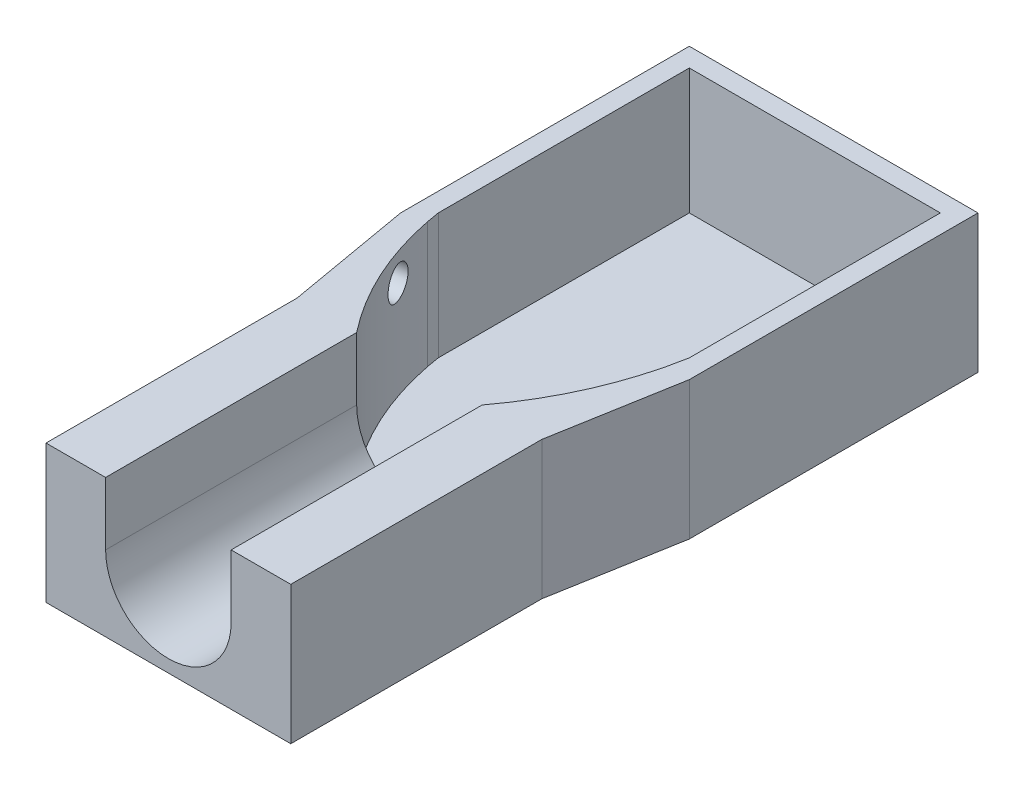
from build123d import *

# Parameters (mm, degrees)
SKETCH1_W           = 46
SKETCH1_H           = 46
SKETCH1_W_2         = 40
SKETCH1_H_2         = 40
BOSS_EXTRUDE1_DEPTH = 20
SKETCH2_W           = 46
SKETCH2_H           = 46
BOSS_EXTRUDE2_DEPTH = 2
BOSS_EXTRUDE3_DEPTH = 22
CUT_EXTRUDE1_DEPTH  = 20
BOSS_EXTRUDE5_DEPTH = 2
BOSS_EXTRUDE6_DEPTH = 40
BOSS_EXTRUDE8_DEPTH = 20
SKETCH12_R          = 2.55
CUT_EXTRUDE4_DEPTH  = 20


with BuildPart() as part:
    # Sketch1 → Boss-Extrude1 (new body)
    with BuildSketch(Plane(origin=(0, 0, 0), x_dir=(1, 0, 0), z_dir=(0, 1, 0))):
        Rectangle(SKETCH1_W, SKETCH1_H)
        Rectangle(SKETCH1_W_2, SKETCH1_H_2, mode=Mode.SUBTRACT)
    extrude(amount=BOSS_EXTRUDE1_DEPTH)

    # Sketch2 → Boss-Extrude2 (add)
    with BuildSketch(Plane.XZ):
        Rectangle(SKETCH2_W, SKETCH2_H)
    extrude(amount=BOSS_EXTRUDE2_DEPTH)

    # Sketch3 → Boss-Extrude3 (add)
    with BuildSketch(Plane(origin=(0, 20, 0), x_dir=(1, 0, 0), z_dir=(0, 1, 0))):
        Polygon((-16, -43), (-19.47826087, -23), (-23, -23), (-19.5, -43), align=None)
        Polygon((23, -23), (19.47826087, -23), (16, -43), (19.5, -43), align=None)
    extrude(amount=-BOSS_EXTRUDE3_DEPTH)

    # Sketch3<3> → Cut-Extrude1 (cut)
    with BuildSketch(Plane(origin=(0, 20, 0), x_dir=(1, 0, 0), z_dir=(0, 1, 0))):
        Polygon((20, -20), (-20, -20), (-19.47826087, -23), (19.47826087, -23), align=None)
    extrude(amount=-CUT_EXTRUDE1_DEPTH, mode=Mode.SUBTRACT)

    # Sketch5 → Boss-Extrude5 (add)
    with BuildSketch(Plane.XZ.offset(2)):
        Polygon((-16, 43), (-19.47826087, 23), (19.47826087, 23), (16, 43), align=None)
    extrude(amount=-BOSS_EXTRUDE5_DEPTH)

    # Sketch6 → Boss-Extrude6 (add)
    with BuildSketch(Plane.XY.offset(43)):
        with BuildLine():
            Line((-10, 10), (-10, 20))
            Line((-10, 20), (-19.5, 20))
            Line((-19.5, 20), (-19.5, -2))
            Line((-19.5, -2), (19.5, -2))
            Line((19.5, -2), (19.5, 20))
            Line((19.5, 20), (10, 20))
            Line((10, 20), (10, 10))
            ThreePointArc((10, 10), (0, 0), (-10, 10))
        make_face()
    extrude(amount=BOSS_EXTRUDE6_DEPTH)

    # Sketch10 → Boss-Extrude8 (add)
    with BuildSketch(Plane(origin=(0, 20, 0), x_dir=(1, 0, 0), z_dir=(0, 1, 0))):
        with BuildLine():
            ThreePointArc((-10, -43), (-16.076894226, -33.091178776), (-19.647093187, -22.029214175))
            Line((-19.647093187, -22.029214175), (-16, -43))
            Line((-16, -43), (-10, -43))
        make_face()
        with BuildLine():
            Line((16, -43), (20, -20))
            ThreePointArc((20, -20), (16.354828561, -32.089055896), (10, -43))
            Line((10, -43), (16, -43))
        make_face()
    extrude(amount=-BOSS_EXTRUDE8_DEPTH)

    # Sketch12 → Cut-Extrude4 (cut)
    with BuildSketch(Plane(origin=(-26.221952699, 0, 4.588841722), x_dir=(0.17238033175224893, 0, 0.9850304671557041), z_dir=(-0.9850304671557042, 0, 0.17238033175224893))):
        with Locations((25.097340794, 15.70534694)):
            Circle(SKETCH12_R)
    extrude(amount=-CUT_EXTRUDE4_DEPTH, mode=Mode.SUBTRACT)


solid = part.part
